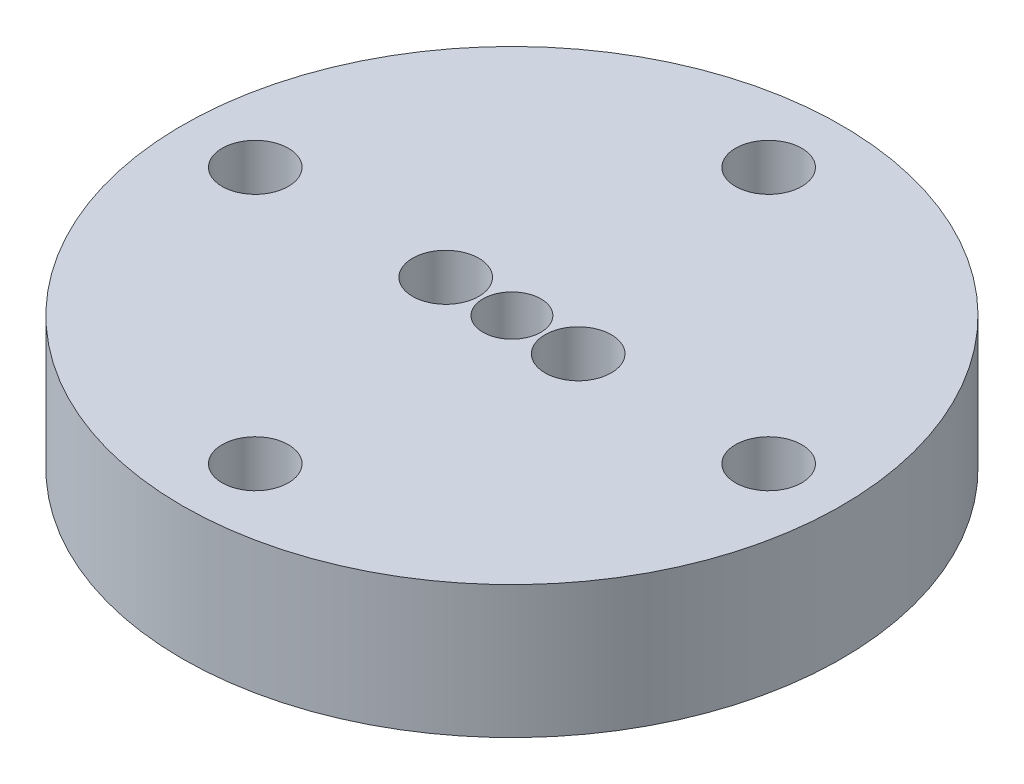
from build123d import *

# Parameters (mm, degrees)
SKETCH1_R           = 19.9
SKETCH1_R_2         = 2
SKETCH1_R_3         = 1.75
BOSS_EXTRUDE1_DEPTH = 8


with BuildPart() as part:
    # Sketch1 → Boss-Extrude1 (new body)
    with BuildSketch(Plane(origin=(0, 0, 0), x_dir=(1, 0, 0), z_dir=(0, 1, 0))):
        Circle(SKETCH1_R)
        with Locations((0, 15.5)):
            Circle(SKETCH1_R_2, mode=Mode.SUBTRACT)
        with Locations((15.5, 0)):
            Circle(SKETCH1_R_2, mode=Mode.SUBTRACT)
        with Locations((0, -15.5)):
            Circle(SKETCH1_R_2, mode=Mode.SUBTRACT)
        with Locations((-15.5, 0)):
            Circle(SKETCH1_R_2, mode=Mode.SUBTRACT)
        with Locations((-4, 0)):
            Circle(SKETCH1_R_2, mode=Mode.SUBTRACT)
        with Locations((4, 0)):
            Circle(SKETCH1_R_2, mode=Mode.SUBTRACT)
        Circle(SKETCH1_R_3, mode=Mode.SUBTRACT)
    extrude(amount=BOSS_EXTRUDE1_DEPTH)


solid = part.part
